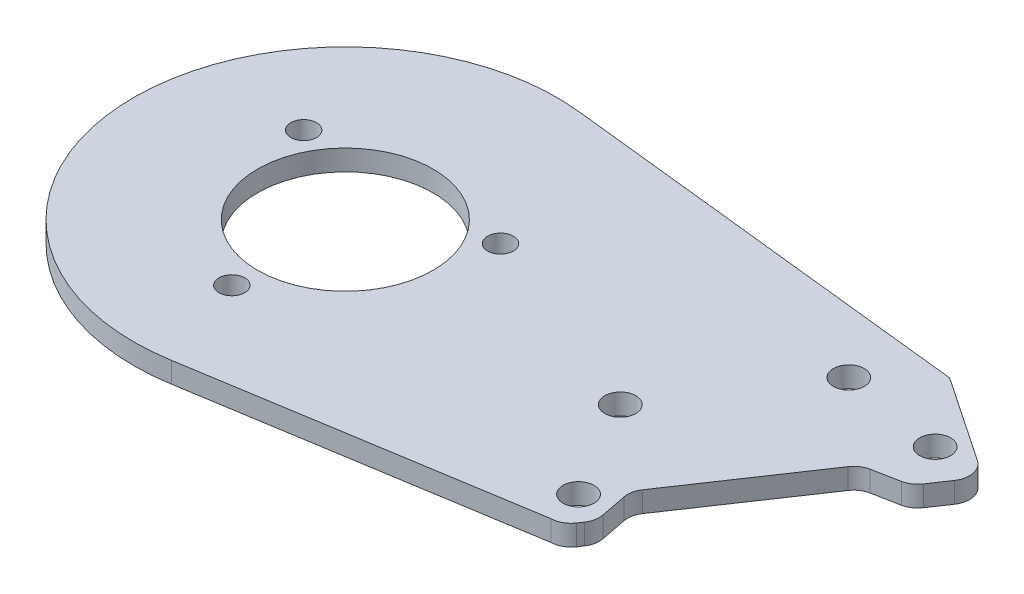
from build123d import *

# Parameters (mm, degrees)
BOSS_EXTRUDE1_DEPTH = 2
SKETCH2_R           = 1.5
CUT_EXTRUDE1_DEPTH  = 162.776916151
FILLET1_R           = 2


with BuildPart() as part:
    # Sketch1 → Boss-Extrude1 (new body)
    with BuildSketch(Plane(origin=(0, 0, 0), x_dir=(1, 0, 0), z_dir=(0, 1, 0))):
        with BuildLine():
            Line((-93.626923886, -57.255296936), (-125.285208035, -62.353434177))
            ThreePointArc((-125.285208035, -62.353434177), (-139.136930256, -59.744510113), (-148.029903031, -48.8087098))
            ThreePointArc((-148.029903031, -48.8087098), (-144.651370762, -29.319378812), (-126.373822338, -21.757651079))
            Line((-126.373822338, -21.757651079), (-86.108085396, -26.140585529))
            Line((-86.108085396, -26.140585529), (-76.160414707, -32.849365164))
            Line((-76.160414707, -32.849365164), (-78.953515167, -36.996483419))
            Line((-78.953515167, -36.996483419), (-83.117646396, -37.808894096))
            Line((-83.117646396, -37.808894096), (-92.055567869, -51.079672511))
            Line((-92.055567869, -51.079672511), (-91.243157193, -55.24380374))
            Line((-91.243157193, -55.24380374), (-92.919017469, -57.732074693))
            Line((-92.919017469, -57.732074693), (-93.626923886, -57.255296936))
        make_face()
        with BuildLine():
            ThreePointArc((-128.01465119, -54.213221054), (-127.558293409, -52.505375167), (-129.266139297, -52.049017386))
            ThreePointArc((-129.266139297, -52.049017386), (-129.722497078, -53.756863273), (-128.01465119, -54.213221054))
        make_face(mode=Mode.SUBTRACT)
        with BuildLine():
            ThreePointArc((-118.499717146, -37.706675985), (-118.043359364, -35.998830097), (-119.751205252, -35.542472316))
            ThreePointArc((-119.751205252, -35.542472316), (-120.207563033, -37.250318204), (-118.499717146, -37.706675985))
        make_face(mode=Mode.SUBTRACT)
        with BuildLine():
            ThreePointArc((-137.552271527, -37.719773921), (-137.095913745, -36.011928034), (-138.803759633, -35.555570253))
            ThreePointArc((-138.803759633, -35.555570253), (-139.260117414, -37.26341614), (-137.552271527, -37.719773921))
        make_face(mode=Mode.SUBTRACT)
        with BuildLine():
            ThreePointArc((-132.903016903, -34.772829346), (-136.006249814, -46.386181381), (-124.392897779, -49.489414293))
            ThreePointArc((-124.392897779, -49.489414293), (-121.289664867, -37.876062257), (-132.903016903, -34.772829346))
        make_face(mode=Mode.SUBTRACT)
    extrude(amount=BOSS_EXTRUDE1_DEPTH)

    # Sketch2 → Cut-Extrude1 (cut, through all)
    with BuildSketch(Plane(origin=(0, 2, 0), x_dir=(1, 0, 0), z_dir=(0, 1, 0))):
        with Locations(Location((-94.319257895, -53.871812037, 0), (0, 0, 270))):
            Circle(SKETCH2_R)
        with Locations(Location((-81.035580782, -32.615630622, 0), (0, 0, 270))):
            Circle(SKETCH2_R)
        with Locations(Location((-99.81641988, -44.328419171, 0), (0, 0, 270))):
            Circle(SKETCH2_R)
        with Locations(Location((-91.026470018, -30.986543755, 0), (0, 0, 270))):
            Circle(SKETCH2_R)
    extrude(amount=-CUT_EXTRUDE1_DEPTH, mode=Mode.SUBTRACT)

    # Fillet1
    # the kernel refuses this fillet: 2 mm, written as the material it adds along each edge
    with BuildSketch(Plane(origin=(-83.117646396, 0, 37.808894096), x_dir=(-0.558620092060103, 0, 0.8294236509448968), z_dir=(0, 1, 0)), Plane(origin=(-92.055567869, 0, 51.079672511), x_dir=(0.191487032856868, 0, 0.9814951432623968), z_dir=(0, 1, 0))) as fillet1_piece_1:
        with BuildLine():
            CenterArc((FILLET1_R * 0.414213562373, FILLET1_R), FILLET1_R, 225, 45)
            Line((-FILLET1_R * 0.292893218813, FILLET1_R * 0.292893218813), (0, 0))
            Line((0, 0), (FILLET1_R * 0.414213562373, 0))
        make_face()
    extrude(amount=2)
    # the kernel refuses this fillet: 2 mm, written as the material it takes off along each edge
    with BuildSketch(Plane(origin=(-76.160414707, -4.996895665, 32.849365164), x_dir=(-0.8290765545202242, 0, -0.5591351059850148), z_dir=(0, 1, 0))) as fillet1_2_piece_1:
        with BuildLine():
            CenterArc((FILLET1_R * 0.999379132971, FILLET1_R), FILLET1_R, 180.035584106, 89.964415894)
            Line((-FILLET1_R * 0.000620674171049, FILLET1_R * 0.999378940233), (0, 0))
            Line((0, 0), (FILLET1_R * 0.999379132971, 0))
        make_face()
    extrude(amount=11.99379133, mode=Mode.SUBTRACT)
    with BuildSketch(Plane(origin=(-78.953515167, -2.071067812, 36.996483419), x_dir=(0.558620092060111, 0, -0.8294236509448913), z_dir=(0, 1, 0))) as fillet1_2_piece_2:
        with BuildLine():
            CenterArc((FILLET1_R * 0.414213562373, FILLET1_R), FILLET1_R, 225, 45)
            Line((-FILLET1_R * 0.292893218813, FILLET1_R * 0.292893218813), (0, 0))
            Line((0, 0), (FILLET1_R * 0.414213562373, 0))
        make_face()
    extrude(amount=6.142135624, mode=Mode.SUBTRACT)
    with BuildSketch(Plane(origin=(-92.919017469, -4.096888539, 57.732074693), x_dir=(-0.8294236509413199, 0, -0.5586200920654141), z_dir=(0, 1, 0))) as fillet1_2_piece_3:
        with BuildLine():
            CenterArc((2, -1.638755416), FILLET1_R, 124.977451645, 55.022548355)
            Line((0, -1.638755416), (0, 0))
            Line((0, 0), (0.853491959, 0))
        make_face()
    extrude(amount=10.193777079, mode=Mode.SUBTRACT)
    with BuildSketch(Plane(origin=(-91.243157193, -2.071067812, 55.24380374), x_dir=(-0.558620092060103, 0, 0.8294236509448968), z_dir=(0, 1, 0))) as fillet1_2_piece_4:
        with BuildLine():
            CenterArc((FILLET1_R * 0.414213562373, -FILLET1_R), FILLET1_R, 90, 45)
            Line((-FILLET1_R * 0.292893218813, -FILLET1_R * 0.292893218813), (0, 0))
            Line((0, 0), (FILLET1_R * 0.414213562373, 0))
        make_face()
    extrude(amount=6.142135624, mode=Mode.SUBTRACT)


solid = part.part
